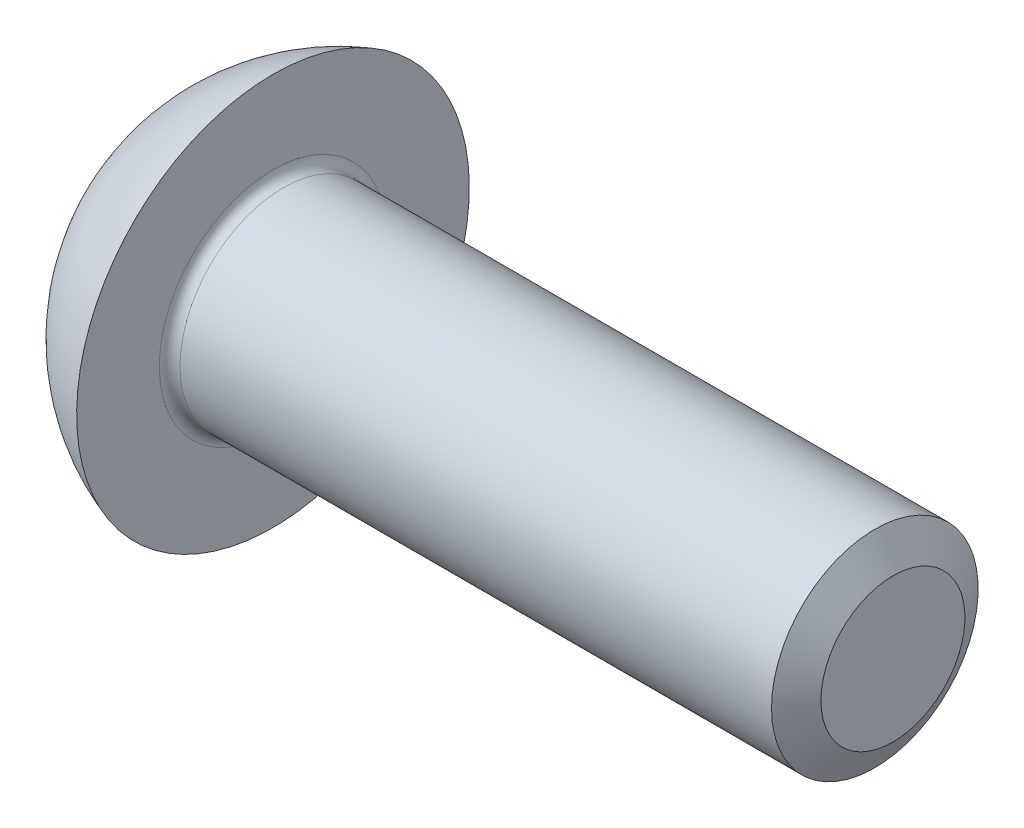
from build123d import *

# Parameters (mm, degrees)
CUT_EXTRUDE_1_DEPTH = 2.2


with BuildPart() as part:
    # 草图1 → 旋转1 (revolve)
    with BuildSketch(Plane.XY):
        with BuildLine():
            Line((0, 2), (-11.8, 2))
            ThreePointArc((-11.8, 2), (-11.941421356, 2.058578644), (-12, 2.2))
            Line((-12, 2.2), (-12, 3.8))
            ThreePointArc((-12, 3.8), (-13.264955669, 3.101612484), (-14.2, 2))
            Line((-14.2, 2), (-14.2, 0))
            Line((-14.2, 0), (0, 0))
            Line((0, 0), (0, 2))
        make_face()
    revolve(axis=Axis((-14.2, 0, 0), (1, 0, 0)))

    # 草图2 → 切除-拉伸1 (cut)
    with BuildSketch(Plane.ZY.offset(14.2)):
        Polygon((0, 1.443375673), (-1.25, 0.721687836), (-1.25, -0.721687836), (0, -1.443375673), (1.25, -0.721687836), (1.25, 0.721687836), align=None)
    extrude(amount=-CUT_EXTRUDE_1_DEPTH, mode=Mode.SUBTRACT)

    # 草图6 → 旋转2 (revolve)
    with BuildSketch(Plane.XY):
        Polygon((-12.9, 1.443375673), (-12, 0), (-11.63, 0), (-11.63, 1.443375673), align=None)
    revolve(axis=Axis((-14.2, 0, 0), (1, 0, 0)))

    # 草图7 → 切除-旋转5 (revolve, cut)
    with BuildSketch(Plane.XY):
        Polygon((-14.2, 1.443375673), (-13.83, 0), (-14.2, 0), align=None)
    revolve(axis=Axis((-14.2, 0, 0), (1, 0, 0)), mode=Mode.SUBTRACT)

    # 草图4 → 切除-旋转1 (revolve, cut)
    with BuildSketch(Plane.XY):
        Polygon((-0.35, 2), (0, 1.393782217), (0.35, 2), align=None)
    revolve(axis=Axis((-0.35, 0, 0), (1, 0, 0)), mode=Mode.SUBTRACT)


solid = part.part
